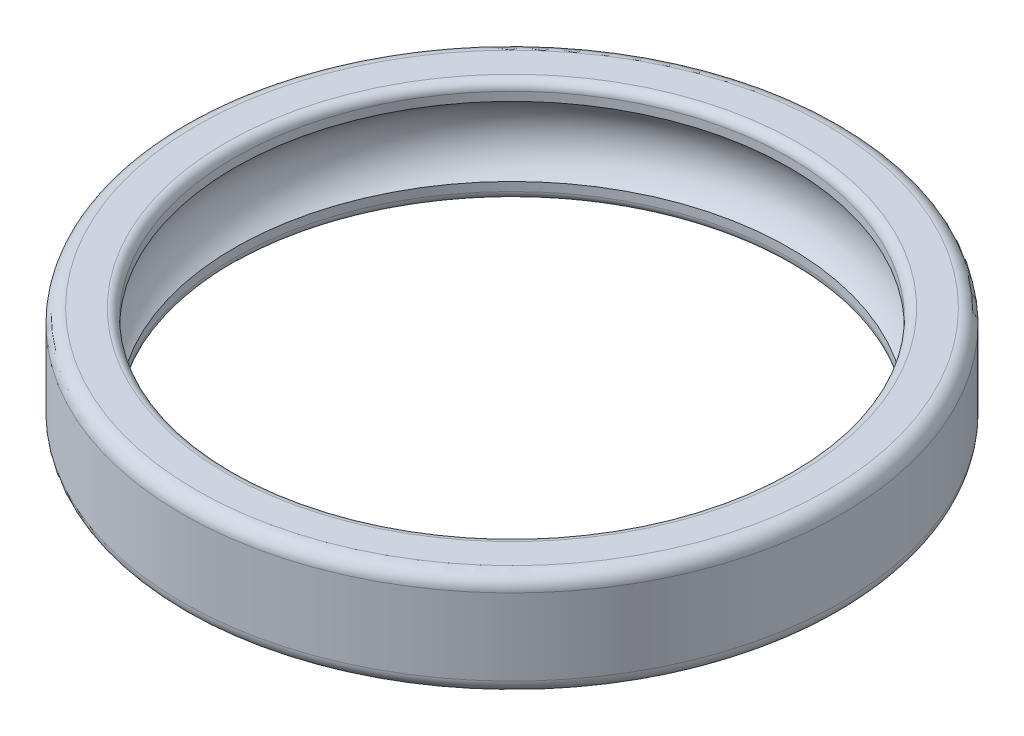
from build123d import *

# Parameters (mm, degrees)
SKETCH_1_R      = 19
SKETCH_1_R_2    = 16
EXTRUDE_1_DEPTH = 6
FILLET_1_R      = 0.8
FILLET_2_R      = 0.5
FILLET_3_R      = 0.5


# Read off the part's stored shape, not the designer's step: 压凹1
with BuildPart() as part:
    # 草图1 → 凸台-拉伸1 (new body)
    with BuildSketch(Plane(origin=(0, 0, 0), x_dir=(1, 0, 0), z_dir=(0, 1, 0))):
        with Locations(Location((0, 0, 0), (0, 0, 270))):
            Circle(SKETCH_1_R)
        with Locations(Location((0, 0, 0), (0, 0, 270))):
            Circle(SKETCH_1_R_2, mode=Mode.SUBTRACT)
    extrude(amount=EXTRUDE_1_DEPTH)

    # 压凹1 outline → 压凹1 (revolve, cut)
    with BuildSketch(Plane.XY):
        with BuildLine():
            Line((16, 5), (16, 1))
            ThreePointArc((16, 1), (17, 3), (16, 5))
        make_face()
    revolve(axis=Axis((0, 0, 0), (0, 1, 0)), mode=Mode.SUBTRACT)

    # 圆角1
    fillet_1_edges = [part.edges().sort_by_distance(p)[0] for p in [
        (0, 0, -19),
        (0, 6, -19),
    ]]
    fillet(fillet_1_edges, radius=FILLET_1_R)

    # 圆角2
    fillet_2_edges = [part.edges().sort_by_distance(p)[0] for p in [
        (0, 0, -16),
    ]]
    fillet(fillet_2_edges, radius=FILLET_2_R)

    # 圆角3
    fillet_3_edges = [part.edges().sort_by_distance(p)[0] for p in [
        (0, 6, -16),
    ]]
    fillet(fillet_3_edges, radius=FILLET_3_R)


solid = part.part
